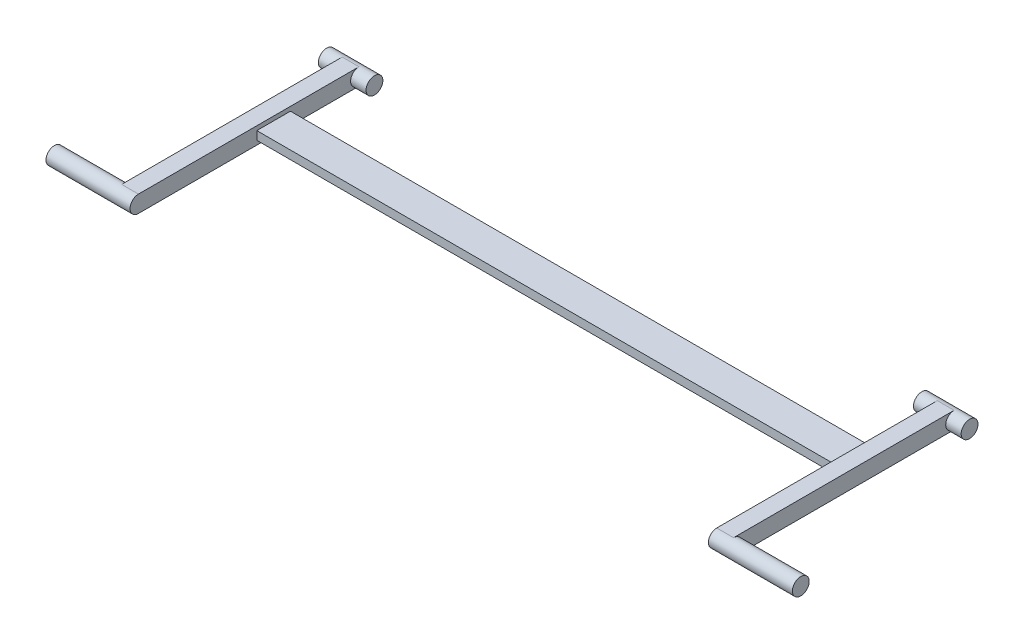
from build123d import *

# Parameters (mm, degrees)
SKETCH1_W           = 218.44
SKETCH1_H           = 12.7
BOSS_EXTRUDE1_DEPTH = 1.5875
BOSS_EXTRUDE3_DEPTH = 6.35
SKETCH3_R           = 3.175
BOSS_EXTRUDE4_DEPTH = 25.4
SKETCH5_R           = 3.175
BOSS_EXTRUDE5_DEPTH = 5.842
BOSS_EXTRUDE6_START = 5.842
SKETCH6_R           = 3.175
BOSS_EXTRUDE6_DEPTH = 5.842


with BuildPart() as part:
    # Sketch1 → Boss-Extrude1 (new, symmetric)
    with BuildSketch(Plane(origin=(0, 0, 0), x_dir=(1, 0, 0), z_dir=(0, 1, 0))):
        Rectangle(SKETCH1_W, SKETCH1_H)
    extrude(amount=BOSS_EXTRUDE1_DEPTH, both=True)

    # Sketch2 → Boss-Extrude3 (add)
    with BuildSketch(Plane(origin=(109.22, 0, 0), x_dir=(0, 0, -1), z_dir=(1, 0, 0))):
        with BuildLine():
            Line((-6.35, 3.175), (-51.054, 3.175))
            ThreePointArc((-51.054, 3.175), (-54.229, 0), (-51.054, -3.175))
            Line((-51.054, -3.175), (-6.35, -3.175))
            Line((-6.35, -3.175), (32.258, -3.175))
            ThreePointArc((32.258, -3.175), (35.433, 0), (32.258, 3.175))
            Line((32.258, 3.175), (-6.35, 3.175))
        make_face()
    boss_extrude3 = extrude(amount=BOSS_EXTRUDE3_DEPTH)

    # Sketch3 → Boss-Extrude4 (add)
    with BuildSketch(Plane(origin=(115.57, 0, 0), x_dir=(0, 0, -1), z_dir=(1, 0, 0))):
        with Locations((-51.054, 0)):
            Circle(SKETCH3_R)
    boss_extrude4 = extrude(amount=BOSS_EXTRUDE4_DEPTH)

    # Sketch5 → Boss-Extrude5 (add)
    with BuildSketch(Plane(origin=(115.57, 0, 0), x_dir=(0, 0, -1), z_dir=(1, 0, 0))):
        with Locations((32.258, 0)):
            Circle(SKETCH5_R)
    boss_extrude5 = extrude(amount=BOSS_EXTRUDE5_DEPTH)

    # Sketch6 → Boss-Extrude6 (add)
    with BuildSketch(Plane.ZY.offset(-109.22).offset(BOSS_EXTRUDE6_START)):
        with Locations((-32.258, 0)):
            Circle(SKETCH6_R)
    boss_extrude6 = extrude(amount=-BOSS_EXTRUDE6_DEPTH)

    # Mirror1: Boss-Extrude3, Boss-Extrude4, Boss-Extrude5, Boss-Extrude6 across plane
    add(boss_extrude3.mirror(Plane(origin=(0, 0, 0), x_dir=(0, 0, 1), z_dir=(1, 0, 0))))
    add(boss_extrude4.mirror(Plane(origin=(0, 0, 0), x_dir=(0, 0, 1), z_dir=(1, 0, 0))))
    add(boss_extrude5.mirror(Plane(origin=(0, 0, 0), x_dir=(0, 0, 1), z_dir=(1, 0, 0))))
    add(boss_extrude6.mirror(Plane(origin=(0, 0, 0), x_dir=(0, 0, 1), z_dir=(1, 0, 0))))


solid = part.part
